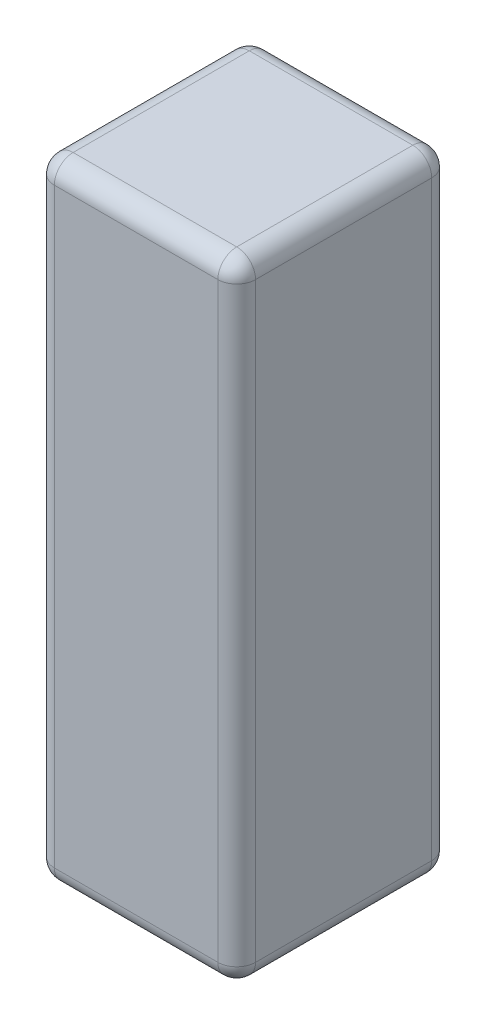
from build123d import *

# Parameters (mm, degrees)
SKETCH1_W           = 32
SKETCH1_H           = 100
BOSS_EXTRUDE1_DEPTH = 34
FILLET1_R           = 3


with BuildPart() as part:
    # Sketch1 → Boss-Extrude1 (new body)
    with BuildSketch(Plane.XY):
        with Locations((46.306042722, -47.349420118)):
            Rectangle(SKETCH1_W, SKETCH1_H)
    extrude(amount=BOSS_EXTRUDE1_DEPTH)

    # Fillet1
    fillet1_edges = [part.edges().sort_by_distance(p)[0] for p in [
        (62.306042722, -47.349420118, 0),
        (30.306042722, -47.349420118, 0),
        (62.306042722, -47.349420118, 34),
        (30.306042722, -47.349420118, 34),
        (62.306042722, 2.650579882, 17),
        (46.306042722, 2.650579882, 34),
        (30.306042722, 2.650579882, 17),
        (46.306042722, 2.650579882, 0),
        (30.306042722, -97.349420118, 17),
        (46.306042722, -97.349420118, 34),
        (62.306042722, -97.349420118, 17),
        (46.306042722, -97.349420118, 0),
    ]]
    fillet(fillet1_edges, radius=FILLET1_R)


solid = part.part
